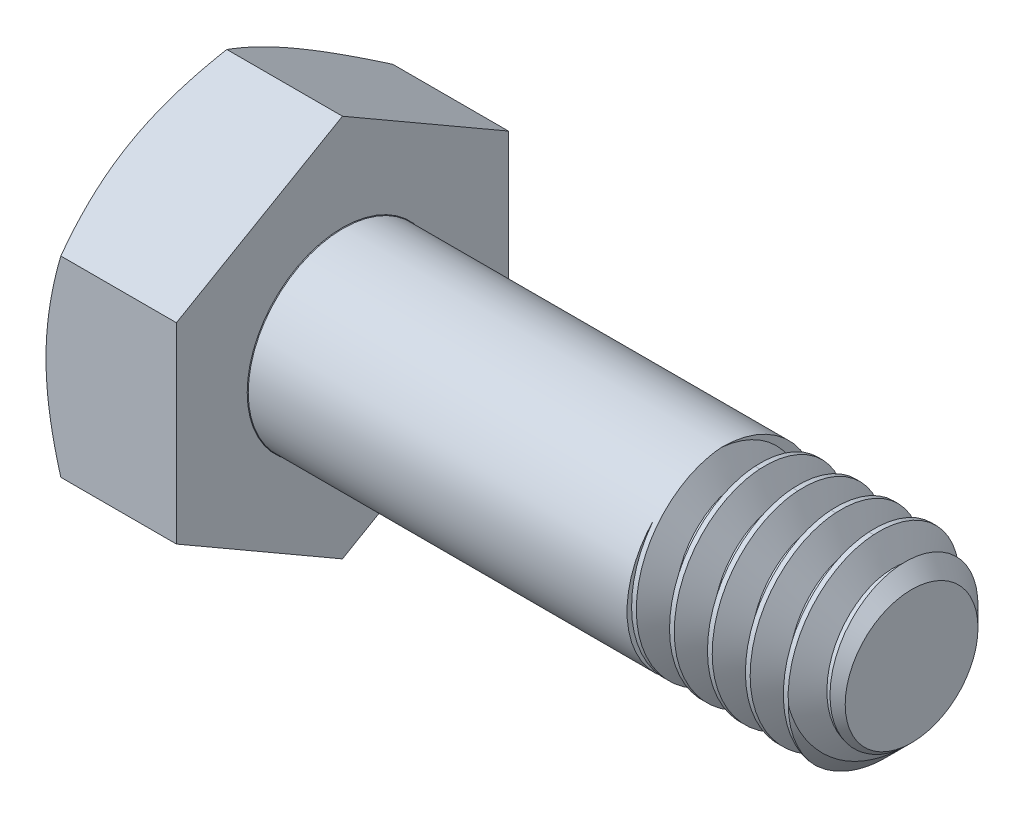
from build123d import *
from build123d.topology import SkipClean

# Parameters (mm, degrees)
BOSS_EXTRUDE4_DEPTH = 4.365625
SKETCH5_R           = 3.175
BOSS_EXTRUDE3_DEPTH = 19.05
SKETCH8_OUTSIDE_W   = 108.638
SKETCH8_OUTSIDE_H   = 110.358
SKETCH8_OUTSIDE_R   = 5.55625
CUT_EXTRUDE3_DEPTH  = 25.906343776
CUT_EXTRUDE3_DRAFT  = -60
CUT_EXTRUDE4_DEPTH  = 0.254
CIRPATTERN1_COUNT   = 6
CHAMFER1_SIZE       = 0.9525
CUT_SWEEP2_PITCH    = 1.27
CUT_SWEEP2_TO       = 19.05
BOSS_EXTRUDE5_START = 12.7
SKETCH14_R          = 3.175
BOSS_EXTRUDE5_DEPTH = 12.7


with BuildPart() as part:
    # Sketch6 → Boss-Extrude4 (new body)
    with BuildSketch(Plane.ZY.offset(7.3421875)):
        Polygon((5.55625, 3.207902433), (0, 6.415804866), (-5.55625, 3.207902433), (-5.55625, -3.207902433), (0, -6.415804866), (5.55625, -3.207902433), align=None)
    extrude(amount=BOSS_EXTRUDE4_DEPTH)

    # Sketch5 → Boss-Extrude3 (add)
    with BuildSketch(Plane(origin=(11.7078125, 0, 0), x_dir=(0, 0, -1), z_dir=(1, 0, 0))):
        Circle(SKETCH5_R)
    extrude(amount=-BOSS_EXTRUDE3_DEPTH)


with BuildPart() as cut_extrude3_tool:
    # Sketch8 outside → Cut-Extrude3 (with draft: the straight prism first)
    with BuildSketch(Plane.ZY.offset(11.7078125)):
        Rectangle(SKETCH8_OUTSIDE_W, SKETCH8_OUTSIDE_H)
        Circle(SKETCH8_OUTSIDE_R, mode=Mode.SUBTRACT)
    extrude(amount=-CUT_EXTRUDE3_DEPTH)
    # Cut-Extrude3: the draft: its side faces are tilted about the plane it starts from
    cut_extrude3_sides = [cut_extrude3_tool.faces().sort_by_distance(p)[0] for p in [
        (1.245359388, -55.179, 0),
        (1.245359388, 0, 54.319),
        (1.245359388, 55.179, 0),
        (1.245359388, 0, -54.319),
        (1.245359388, 0, -5.55625),
    ]]
    draft(cut_extrude3_sides, Plane.ZY.offset(11.7078125), CUT_EXTRUDE3_DRAFT)


with BuildPart() as part_1:
    add(part.part)

    # Cut-Extrude3: cut by cut_extrude3_tool
    add(cut_extrude3_tool.part, mode=Mode.SUBTRACT)

    # Sketch12 → Cut-Extrude4 (cut)
    with BuildSketch(Plane.ZY.offset(11.7078125)):
        with BuildLine():
            Line((0.1666875, 4.2783125), (0.1666875, 2.3891875))
            ThreePointArc((0.1666875, 2.3891875), (0, 2.2225), (-0.1666875, 2.3891875))
            Line((-0.1666875, 2.3891875), (-0.1666875, 4.2783125))
            ThreePointArc((-0.1666875, 4.2783125), (0, 4.445), (0.1666875, 4.2783125))
        make_face()
    cut_extrude4 = extrude(amount=-CUT_EXTRUDE4_DEPTH, mode=Mode.SUBTRACT)

    # CirPattern1: Cut-Extrude4 ×6 about axis
    cirpattern1_axis = Axis((0, 0, 0), (1, 0, 0))
    for i in range(1, CIRPATTERN1_COUNT):
        add(cut_extrude4.rotate(cirpattern1_axis, i * 360 / CIRPATTERN1_COUNT), mode=Mode.SUBTRACT)

    # Chamfer1
    chamfer1_edges = [part_1.edges().sort_by_distance(p)[0] for p in [
        (11.7078125, 0, 3.175),
    ]]
    chamfer(chamfer1_edges, length=CHAMFER1_SIZE)


with BuildPart() as body_2:
    # Split1: read off the stored shape, not the designer's step
    # Split1: the piece on the far side of the plane
    add(part_1.part)
    split(bisect_by=Plane.YZ.offset(-7.3421875), keep=Keep.BOTTOM)


with BuildPart() as part_2:
    add(part_1.part)

    # Split1
    split(bisect_by=Plane.YZ.offset(-7.3421875), keep=Keep.TOP)

    # Cut-Sweep2: arcs per turn and ends read off the stored shape
    # Cut-Sweep2: the profile of Sketch10 screwed along a right-hand helix through 16 turns, 8 arcs to a turn; built about Z, then put on its axis
    cut_sweep2_z = Axis((0, 0, 0), (0, 0, 1))
    cut_sweep2_corners = [(3.243740766, 0, 0.0396875), (3.243740766, 0, -1.1509375), (2.350110803, 0, -0.635), (2.350110803, 0, -0.47625)]
    with BuildLine(mode=Mode.PRIVATE) as cut_sweep2_profile:
        Line(cut_sweep2_corners[0], cut_sweep2_corners[1])
        Line(cut_sweep2_corners[1], cut_sweep2_corners[2])
        Line(cut_sweep2_corners[2], cut_sweep2_corners[3])
        Line(cut_sweep2_corners[3], cut_sweep2_corners[0])
    cut_sweep2_cap = Face(cut_sweep2_profile.wire())
    cut_sweep2_turn_angles = [0, 22.5, 45, 67.5, 90, 112.5, 135, 157.5, 180, 202.5, 225, 247.5, 270, 292.5, 315, 337.5, 360]
    cut_sweep2_turn_weights = [1, 0.9238795325112867, 1, 0.9238795325112867, 1, 0.9238795325112867, 1, 0.9238795325112867, 1, 0.9238795325112867, 1, 0.9238795325112867, 1, 0.9238795325112867, 1, 0.9238795325112867, 1]
    cut_sweep2_turn_rails = [Edge.make_bspline([Vector(p[0], p[1], 0).rotate(cut_sweep2_z, cut_sweep2_turn_angles[k]) / cut_sweep2_turn_weights[k] + Vector(0, 0, p[2] + CUT_SWEEP2_PITCH * cut_sweep2_turn_angles[k] / 360) for k in range(17)], [0, 0, 0, 1, 1, 2, 2, 3, 3, 4, 4, 5, 5, 6, 6, 7, 7, 8, 8, 8], 2, cut_sweep2_turn_weights) for p in cut_sweep2_corners]
    cut_sweep2_turn_sides = [Face.make_surface_from_curves(cut_sweep2_turn_rails[p[0]], cut_sweep2_turn_rails[p[1]]) for p in [(0, 1), (1, 2), (2, 3), (3, 0)]]
    cut_sweep2 = Plane(origin=(11.7078125, 0, 0), x_dir=(0, 1, 0), z_dir=(-1, 0, 0)) * split(Solid(Shell([*[p.moved(Location((0, 0, CUT_SWEEP2_PITCH * i))) for i in range(16) for p in cut_sweep2_turn_sides], cut_sweep2_cap, cut_sweep2_cap.rotate(cut_sweep2_z, 5760).moved(Location((0, 0, CUT_SWEEP2_PITCH * 5760 / 360)))])), bisect_by=Plane.XY.offset(CUT_SWEEP2_TO), keep=Keep.BOTTOM, mode=Mode.PRIVATE)
    add(cut_sweep2, mode=Mode.SUBTRACT)

    add(body_2.part)  # Revolve7 merges body 2
    # Sketch13 → Revolve7 (revolve)
    with BuildSketch(Plane.XY, mode=Mode.PRIVATE) as revolve7_sk:
        Polygon((-7.5961875, 0), (-1.820929141, 0), (-7.3421875, 3.1877), (-7.5961875, 3.1877), align=None)
    revolve(revolve7_sk.sketch.rotate(Axis((-7.5961875, 0, 0), (1, 0, 0)), 180), axis=Axis((-7.5961875, 0, 0), (1, 0, 0)))

    # Sketch14 → Boss-Extrude5 (add)
    with SkipClean():  # the faces are left unmerged after this step: merging them gives an invalid solid
        with BuildSketch(Plane(origin=(-7.3421875, 0, 0), x_dir=(0, 0, -1), z_dir=(1, 0, 0)).offset(BOSS_EXTRUDE5_START)):
            with Locations(Location((0, 0, 0), (0, 0, 90))):
                Circle(SKETCH14_R)
        extrude(amount=-BOSS_EXTRUDE5_DEPTH)


solid = part_2.part
